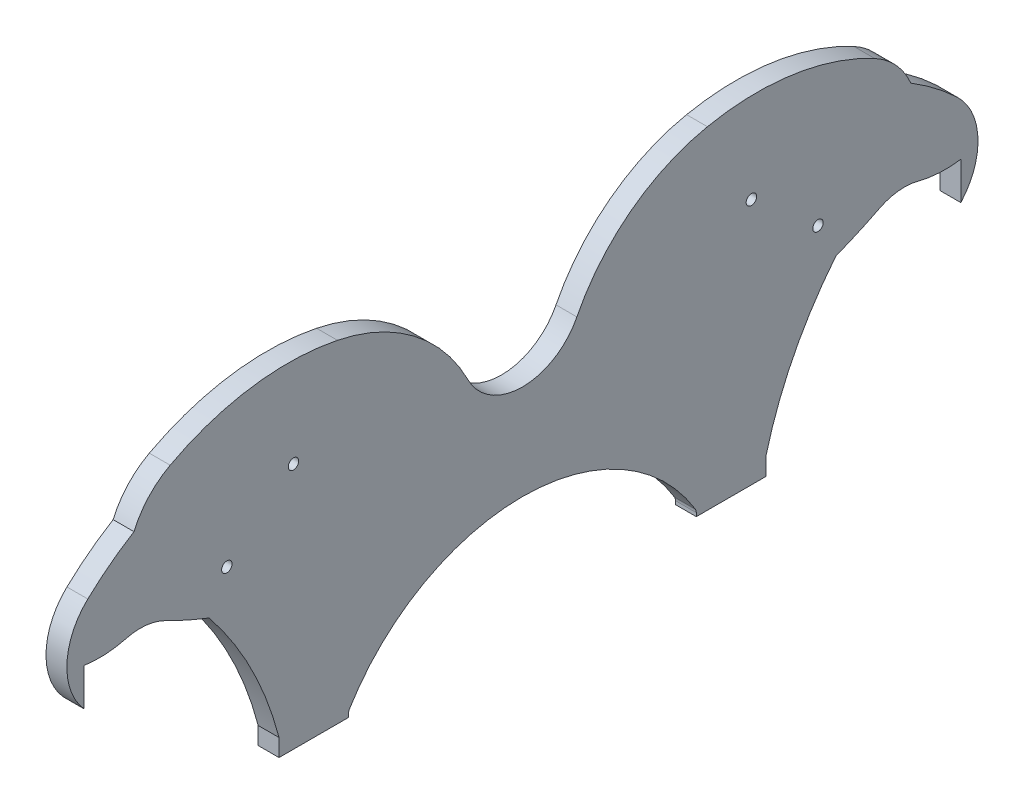
from build123d import *

# Parameters (mm, degrees)
SKETCH1_R           = 1.5
BOSS_EXTRUDE1_DEPTH = 6


with BuildPart() as part:
    # Sketch1 → Boss-Extrude1 (new body)
    with BuildSketch(Plane(origin=(0, 0, 0), x_dir=(0, 0, -1), z_dir=(1, 0, 0))):
        with BuildLine():
            Line((196.078825226, 40.180075233), (196.078825226, 50.979365299))
            ThreePointArc((196.078825226, 50.979365299), (189.975500941, 50.693880489), (183.939217176, 51.640108379))
            ThreePointArc((183.939217176, 51.640108379), (178.164859061, 52.071297171), (172.615566862, 50.417667371))
            ThreePointArc((172.615566862, 50.417667371), (166.451552527, 47.470825055), (160.144108625, 44.844972089))
            ThreePointArc((160.144108625, 44.844972089), (147.939059776, 26.000847287), (140, 5))
            Line((140, 5), (140, -0.001398516))
            Line((140, -0.001398516), (120, -0.001398516))
            Line((120, -0.001398516), (120, 1))
            ThreePointArc((120, 1), (119.925920183, 1.539287908), (119.709168552, 2.038625466))
            ThreePointArc((119.709168552, 2.038625466), (98.516603029, 22.529202299), (70, 29.998601477))
            Line((70, 29.998601477), (70, 57.304525864))
            ThreePointArc((70, 57.304525864), (79.187885543, 59.902270586), (85.655338902, 66.926341019))
            ThreePointArc((85.655338902, 66.926341019), (101.146271035, 85.53721116), (123.200978113, 95.533378497))
            ThreePointArc((123.200978113, 95.533378497), (147.869029366, 96.20403013), (171.305308754, 88.477236835))
            ThreePointArc((171.305308754, 88.477236835), (177.474726549, 83.689677851), (181.712155846, 77.13020913))
            ThreePointArc((181.712155846, 77.13020913), (188.620975333, 72.413498002), (194.997685292, 66.999006272))
            ThreePointArc((194.997685292, 66.999006272), (201.003768499, 53.809869617), (196.078825226, 40.180075233))
        make_face()
        with Locations((155, 54.998601484)):
            Circle(SKETCH1_R, mode=Mode.SUBTRACT)
        with Locations((135.848888922, 71.068291726)):
            Circle(SKETCH1_R, mode=Mode.SUBTRACT)
    boss_extrude1 = extrude(amount=BOSS_EXTRUDE1_DEPTH)

    # Sketch2 → Tap Drill for M3 Tap1 (revolve, cut)
    with BuildSketch(Plane(origin=(3, -0.001398516, -130), x_dir=(0, 0, -1), z_dir=(1, 0, 0))):
        Polygon((0, 0), (0, 10.751075774), (1.25, 10), (1.25, 0), align=None)
    tap_drill_for_m3_tap1 = revolve(axis=Axis((3, -6.351398516, -130), (0, 1, 0)), mode=Mode.SUBTRACT)

    # Mirror1: Boss-Extrude1, Tap Drill for M3 Tap1 across plane
    add(boss_extrude1.mirror(Plane(origin=(6, 57.304525864, -70), x_dir=(1, 0, 0), z_dir=(0, 0, -1))))
    add(tap_drill_for_m3_tap1.mirror(Plane(origin=(6, 57.304525864, -70), x_dir=(1, 0, 0), z_dir=(0, 0, -1))), mode=Mode.SUBTRACT)


solid = part.part
